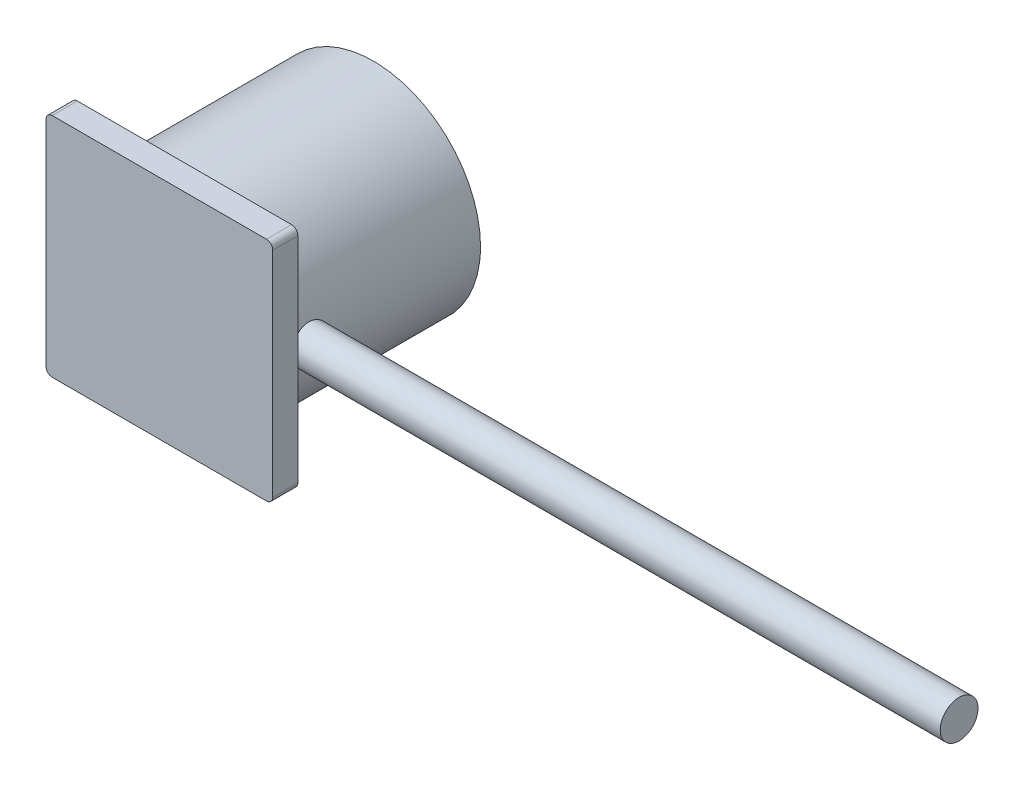
from build123d import *

# Parameters (mm, degrees)
ESQUISSE1_R        = 85
BOSS_EXTRU_1_DEPTH = 150
ESQUISSE2_W        = 180
ESQUISSE2_H        = 180
BOSS_EXTRU_2_DEPTH = 20
CONG_1_R           = 5
CONG_2_R           = 5
CONG_3_R           = 5
CONG_4_R           = 5
CONG_5_R           = 5
ESQUISSE4_R        = 15
BOSS_EXTRU_3_DEPTH = 600


with BuildPart() as part:
    # Esquisse1 → Boss.-Extru.1 (new body)
    with BuildSketch(Plane.XY):
        Circle(ESQUISSE1_R)
    extrude(amount=BOSS_EXTRU_1_DEPTH)

    # Esquisse2 → Boss.-Extru.2 (add)
    with BuildSketch(Plane.XY.offset(150)):
        Rectangle(ESQUISSE2_W, ESQUISSE2_H)
    extrude(amount=BOSS_EXTRU_2_DEPTH)

    # Congé1
    cong_1_edges = [part.edges().sort_by_distance(p)[0] for p in [
        (-85, 0, 150),
    ]]
    fillet(cong_1_edges, radius=CONG_1_R - 0.0001)  # a hair under: the kernel refuses the full size

    # Congé2
    cong_2_edges = [part.edges().sort_by_distance(p)[0] for p in [
        (-90, 90, 160),
    ]]
    fillet(cong_2_edges, radius=CONG_2_R)

    # Congé3
    cong_3_edges = [part.edges().sort_by_distance(p)[0] for p in [
        (-90, -90, 160),
    ]]
    fillet(cong_3_edges, radius=CONG_3_R)

    # Congé4
    cong_4_edges = [part.edges().sort_by_distance(p)[0] for p in [
        (90, 90, 160),
    ]]
    fillet(cong_4_edges, radius=CONG_4_R)

    # Congé5
    cong_5_edges = [part.edges().sort_by_distance(p)[0] for p in [
        (90, -90, 160),
    ]]
    fillet(cong_5_edges, radius=CONG_5_R)

    # Esquisse4 → Boss.-Extru.3 (add)
    with BuildSketch(Plane(origin=(0, 0, 0), x_dir=(0, 0, -1), z_dir=(1, 0, 0))):
        with Locations(Location((-135, 0, 0), (0, 0, 180))):
            Circle(ESQUISSE4_R)
    extrude(amount=BOSS_EXTRU_3_DEPTH)


solid = part.part
